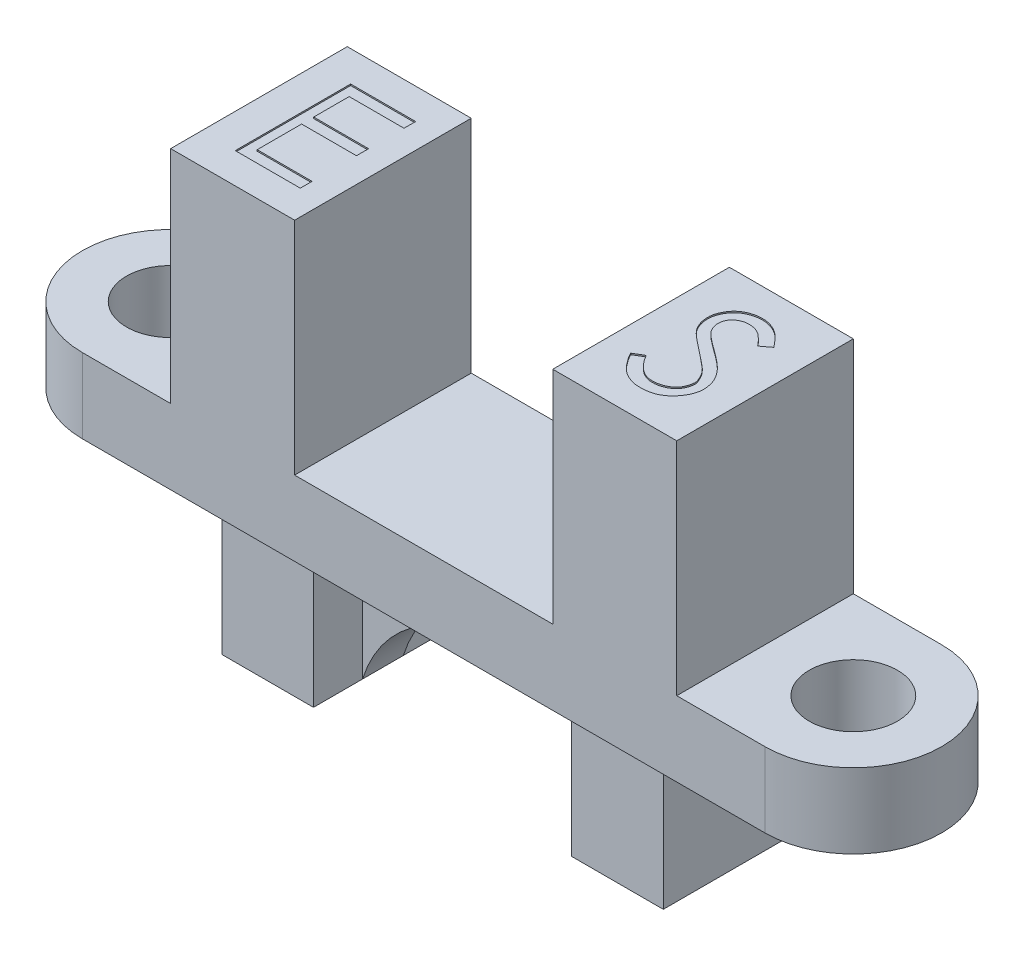
from build123d import *

# Parameters (mm, degrees)
BOSS_EXTRUDE3_DEPTH = 11.049
SKETCH2_W           = 9.652
SKETCH2_H           = 6.604
SKETCH2_W_2         = 6.604
CUT_EXTRUDE1_DEPTH  = 8.255
SKETCH5_W           = 3.429
SKETCH5_H           = 5.08
BOSS_EXTRUDE4_DEPTH = 5.08
SKETCH6_W           = 9.652
SKETCH6_H           = 1.524
BOSS_EXTRUDE5_DEPTH = 5.08
CUT_EXTRUDE3_DEPTH  = 5.08
CUT_EXTRUDE4_START  = -0.0508
CUT_EXTRUDE4_DEPTH  = 0.0508
CUT_EXTRUDE5_DEPTH  = 0.0508


# Read off the part's stored shape, not the designer's step: Cut-Extrude4
with BuildPart() as part:
    # Sketch1 → Boss-Extrude3 (new body)
    with BuildSketch(Plane(origin=(0, 0, 0), x_dir=(1, 0, 0), z_dir=(0, 1, 0))):
        with BuildLine():
            ThreePointArc((-12.7635, 3.302), (-16.0655, 0), (-12.7635, -3.302))
            Line((-12.7635, -3.302), (-12.7635, -1.651))
            ThreePointArc((-12.7635, -1.651), (-14.4145, 0), (-12.7635, 1.651))
            Line((-12.7635, 1.651), (-12.7635, 3.302))
        make_face()
        with BuildLine():
            Line((-12.7635, -1.651), (-12.7635, -3.302))
            ThreePointArc((-12.7635, -3.302), (-10.428633409, -2.334866591), (-9.4615, 0))
            ThreePointArc((-9.4615, 0), (-10.428633409, 2.334866591), (-12.7635, 3.302))
            Line((-12.7635, 3.302), (-12.7635, 1.651))
            ThreePointArc((-12.7635, 1.651), (-11.596066704, 1.167433296), (-11.1125, 0))
            ThreePointArc((-11.1125, 0), (-11.596066704, -1.167433296), (-12.7635, -1.651))
        make_face()
        with BuildLine():
            Line((-12.7635, -3.302), (12.7635, -3.302))
            ThreePointArc((12.7635, -3.302), (9.4615, 0), (12.7635, 3.302))
            Line((12.7635, 3.302), (-12.7635, 3.302))
            ThreePointArc((-12.7635, 3.302), (-10.428633409, 2.334866591), (-9.4615, 0))
            ThreePointArc((-9.4615, 0), (-10.428633409, -2.334866591), (-12.7635, -3.302))
        make_face()
        with BuildLine():
            ThreePointArc((12.7635, 3.302), (9.4615, 0), (12.7635, -3.302))
            Line((12.7635, -3.302), (12.7635, -1.651))
            ThreePointArc((12.7635, -1.651), (11.1125, 0), (12.7635, 1.651))
            Line((12.7635, 1.651), (12.7635, 3.302))
        make_face()
        with BuildLine():
            Line((12.7635, -1.651), (12.7635, -3.302))
            ThreePointArc((12.7635, -3.302), (15.098366591, -2.334866591), (16.0655, 0))
            ThreePointArc((16.0655, 0), (15.098366591, 2.334866591), (12.7635, 3.302))
            Line((12.7635, 3.302), (12.7635, 1.651))
            ThreePointArc((12.7635, 1.651), (13.930933296, 1.167433296), (14.4145, 0))
            ThreePointArc((14.4145, 0), (13.930933296, -1.167433296), (12.7635, -1.651))
        make_face()
    extrude(amount=BOSS_EXTRUDE3_DEPTH)

    # Sketch2 → Cut-Extrude1 (cut)
    with BuildSketch(Plane(origin=(0, 11.049, 0), x_dir=(1, 0, 0), z_dir=(0, 1, 0))):
        Rectangle(SKETCH2_W, SKETCH2_H)
        with Locations((12.7635, 0)):
            Rectangle(SKETCH2_W_2, SKETCH2_H)
        with Locations((-12.7635, 0)):
            Rectangle(SKETCH2_W_2, SKETCH2_H)
    extrude(amount=-CUT_EXTRUDE1_DEPTH, mode=Mode.SUBTRACT)

    # Sketch5 → Boss-Extrude4 (add)
    with BuildSketch(Plane.XZ):
        with Locations((6.5405, 0.056957201)):
            Rectangle(SKETCH5_W, SKETCH5_H)
        with Locations((-6.5405, 0.056957201)):
            Rectangle(SKETCH5_W, SKETCH5_H)
    extrude(amount=BOSS_EXTRUDE4_DEPTH)

    # Sketch6 → Boss-Extrude5 (add)
    with BuildSketch(Plane.XZ):
        Rectangle(SKETCH6_W, SKETCH6_H)
    extrude(amount=BOSS_EXTRUDE5_DEPTH)

    # Sketch7 → Cut-Extrude3 (cut)
    with BuildSketch(Plane.XY.offset(0.762)):
        with BuildLine():
            ThreePointArc((-4.826, -5.08), (-0.756934481, -11.57255329), (5.052785714, -6.576785714))
            ThreePointArc((5.052785714, -6.576785714), (4.995767575, -5.819851233), (4.826, -5.08))
            Line((4.826, -5.08), (-4.826, -5.08))
        make_face()
        with BuildLine():
            Line((-4.826, -5.08), (4.826, -5.08))
            ThreePointArc((4.826, -5.08), (2.997307625, -2.50901108), (0, -1.524))
            ThreePointArc((0, -1.524), (-2.997307625, -2.50901108), (-4.826, -5.08))
        make_face()
    extrude(amount=-CUT_EXTRUDE3_DEPTH, mode=Mode.SUBTRACT)

    # Cut-Extrude4 outline → Cut-Extrude4 (cut)
    with BuildSketch(Plane(origin=(0, 11.049, 0), x_dir=(1, 0, 0), z_dir=(0, 1, 0)).offset(CUT_EXTRUDE4_START)):
        with BuildLine():
            Line((6.125651291, -1.107505234), (5.764715133, -1.322388012))
            add(Edge.make_bspline(
                [(5.764715133, -1.322388012), (5.795848726, -1.396544386), (5.855526361, -1.499286266), (5.978159662, -1.669974458), (6.05114933, -1.775594986), (6.148137968, -1.884253365), (6.256046735, -1.979672728), (6.372017343, -2.072531851), (6.478000588, -2.125037114), (6.583983834, -2.177542378), (6.687715089, -2.205891048), (6.772837481, -2.228601824), (6.855428053, -2.259126551), (6.956720766, -2.259126551), (7.082059087, -2.259126551), (7.202566961, -2.259126551), (7.355228923, -2.239958049), (7.545854824, -2.189191034), (7.64564176, -2.137070791), (7.756302185, -2.074391176), (7.861852333, -1.998233742), (7.956762183, -1.91923746), (8.138419792, -1.696975289), (8.222600111, -1.522442374), (8.284179667, -1.341062147), (8.308803358, -1.188392086), (8.308803358, -1.045195403), (8.257662319, -0.813306269), (8.216986985, -0.673773492), (8.132229192, -0.510521819), (7.993166094, -0.321750968), (7.909998502, -0.224416829), (7.802295587, -0.121226034), (7.6621337, 0.004412918), (7.5566666, 0.088832099), (7.079288797, 0.442114266), (6.827397054, 0.625925615), (6.758715893, 0.678132356), (6.698618911, 0.734864272), (6.648436244, 0.783693405), (6.615575385, 0.819143072), (6.575738864, 0.868399704), (6.535888686, 0.916871649), (6.495665853, 0.988895848), (6.455893708, 1.086814708), (6.435475968, 1.172671893), (6.422326559, 1.281945673), (6.441309585, 1.39829107), (6.467008859, 1.482949614), (6.517139065, 1.57939298), (6.576546974, 1.648262165), (6.660252521, 1.721257683), (6.76204807, 1.770361107), (6.850036001, 1.799422275), (6.919376094, 1.821827394), (7.000254698, 1.821827394), (7.060862271, 1.821827394), (7.158295762, 1.821827394), (7.245490979, 1.805342484), (7.330857485, 1.780448172), (7.394182968, 1.74575823), (7.422569964, 1.733524046), (7.454232705, 1.716179075), (7.490911825, 1.697072046), (7.514106284, 1.676478569), (7.564005826, 1.643675962), (7.656944095, 1.554409737), (7.739669602, 1.474435351), (7.776778642, 1.43169931), (7.842489762, 1.361666912), (7.905039475, 1.278267425)],
                knots=[0, 0, 0, 0, 0, 0, 0, 0, 0.015625, 0.03125, 0.046875, 0.0625, 0.078125, 0.09375, 0.109375, 0.125, 0.140625, 0.15625, 0.171875, 0.1875, 0.203125, 0.21875, 0.234375, 0.25, 0.265625, 0.28125, 0.296875, 0.3125, 0.328125, 0.34375, 0.359375, 0.375, 0.390625, 0.40625, 0.421875, 0.4375, 0.453125, 0.46875, 0.484375, 0.5, 0.515625, 0.53125, 0.546875, 0.5625, 0.578125, 0.59375, 0.609375, 0.625, 0.640625, 0.65625, 0.671875, 0.6875, 0.703125, 0.71875, 0.734375, 0.75, 0.765625, 0.78125, 0.796875, 0.8125, 0.828125, 0.84375, 0.859375, 0.875, 0.890625, 0.90625, 0.921875, 0.9375, 0.953125, 0.96875, 0.984375, 1, 1, 1, 1, 1, 1, 1, 1], degree=7))
            Line((7.905039475, 1.278267425), (8.253289165, 1.539455103))
            add(Edge.make_bspline(
                [(8.253289165, 1.539455103), (8.156895883, 1.66119447), (8.080596703, 1.752467641), (8.009921379, 1.822625174), (7.933726759, 1.919905891), (7.824588167, 2.017677373), (7.667478791, 2.113158926), (7.554717937, 2.174929753), (7.426668873, 2.21890102), (7.295363504, 2.247898039), (7.181818455, 2.267110724), (7.014103692, 2.267110724), (6.815864787, 2.237013824), (6.659136337, 2.182262131), (6.55037867, 2.129800369), (6.423181047, 2.050572345), (6.335021768, 1.976771869), (6.231051482, 1.855134106), (6.149145224, 1.716981286), (6.084448013, 1.567732126), (6.040533381, 1.421764923), (6.040533381, 1.293676397), (6.040533381, 1.143393573), (6.070495088, 0.985652762), (6.137396877, 0.821399612), (6.210558512, 0.692920171), (6.259072046, 0.646259485), (6.293158014, 0.580378426), (6.471822739, 0.420467618), (6.75149803, 0.193678775), (6.790287956, 0.170783169), (7.498283405, -0.384707414), (7.577864327, -0.459159137), (7.65987138, -0.544113603), (7.728973771, -0.621025877), (7.79510367, -0.718827072), (7.865584999, -0.866409444), (7.892864321, -0.947931981), (7.924722723, -1.016219237), (7.924722723, -1.066155835), (7.908904135, -1.168139886), (7.908904135, -1.225535848), (7.873403325, -1.31658975), (7.846091508, -1.386832441), (7.81374531, -1.446533535), (7.789405983, -1.495887306), (7.72836903, -1.555160993), (7.677947198, -1.604126212), (7.627570897, -1.65047546), (7.548458311, -1.699013274), (7.474880936, -1.729316994), (7.409037252, -1.764969223), (7.304160871, -1.794806682), (7.188897018, -1.818103802), (7.115683884, -1.818103802), (7.027185487, -1.818103802), (6.93589672, -1.818103802), (6.863229947, -1.796088084), (6.759400758, -1.765758188), (6.658680651, -1.706691455), (6.586423649, -1.661131989), (6.506706136, -1.594528182), (6.442547065, -1.533389449), (6.378433525, -1.469634745), (6.304296754, -1.382180872), (6.232995884, -1.281685995), (6.192311068, -1.220896958), (6.149245652, -1.146989207), (6.125651291, -1.107505234)],
                knots=[0, 0, 0, 0, 0, 0, 0, 0, 0.016129032, 0.032258065, 0.048387097, 0.064516129, 0.080645161, 0.096774194, 0.112903226, 0.129032258, 0.14516129, 0.161290323, 0.177419355, 0.193548387, 0.209677419, 0.225806452, 0.241935484, 0.258064516, 0.274193548, 0.290322581, 0.306451613, 0.322580645, 0.338709677, 0.35483871, 0.370967742, 0.387096774, 0.403225806, 0.419354839, 0.435483871, 0.451612903, 0.467741935, 0.483870968, 0.5, 0.516129032, 0.532258065, 0.548387097, 0.564516129, 0.580645161, 0.596774194, 0.612903226, 0.629032258, 0.64516129, 0.661290323, 0.677419355, 0.693548387, 0.709677419, 0.725806452, 0.741935484, 0.758064516, 0.774193548, 0.790322581, 0.806451613, 0.822580645, 0.838709677, 0.85483871, 0.870967742, 0.887096774, 0.903225806, 0.919354839, 0.935483871, 0.951612903, 0.967741935, 0.983870968, 1, 1, 1, 1, 1, 1, 1, 1], degree=7))
        make_face()
    extrude(amount=CUT_EXTRUDE4_DEPTH, mode=Mode.SUBTRACT)

    # Sketch10 → Cut-Extrude5 (cut)
    with BuildSketch(Plane(origin=(0, 11.049, 0), x_dir=(1, 0, 0), z_dir=(0, 1, 0))):
        Polygon((-5.758009801, 2.155020867), (-5.758009801, 1.720550301), (-7.809265142, 1.720550301), (-7.809265142, 0.395375626), (-5.758009801, 0.395375626), (-5.758009801, -0.057812947), (-7.809265142, -0.057812947), (-7.809265142, -1.718355868), (-5.758009801, -1.718355868), (-5.758009801, -2.159), (-8.188893002, -2.159), (-8.188893002, 2.155020867), align=None)
    extrude(amount=-CUT_EXTRUDE5_DEPTH, mode=Mode.SUBTRACT)


solid = part.part
